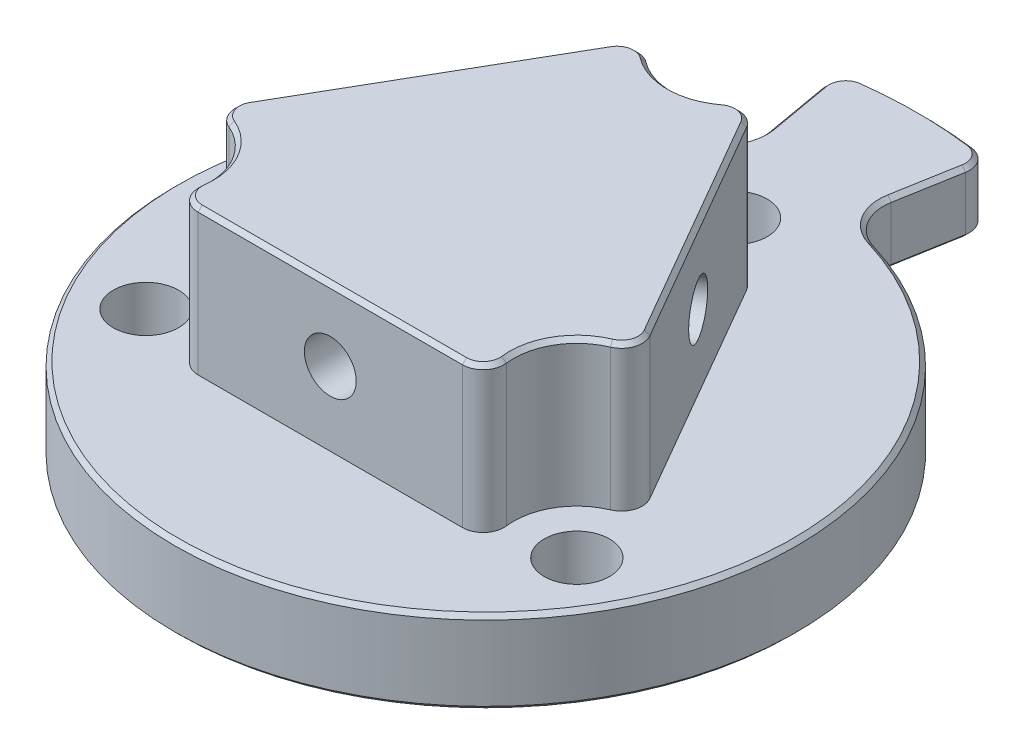
from build123d import *

# Parameters (mm, degrees)
SKETCH_1_R               = 15
SKETCH_1_R_2             = 1.575
EXTRUDE_1_DEPTH          = 4
EXTRUDE_2_DEPTH          = 7
SKETCH_8_R               = 3.05
CUT_EXTRUDE_3_DEPTH      = 7
FILLET_4_R               = 1
SKETCH_10_R              = 1
CUT_EXTRUDE_4_DEPTH      = 5
PATTERN_CIRCULAR_2_COUNT = 3
EXTRUDE_3_DEPTH          = 3
FILLET_5_R               = 1
FILLET_7_R               = 2
CHAMFER_1_SIZE           = 0.2
F_3_0MM_1_D              = 3
F_3_0MM_1_DEPTH          = 3
F_3_0MM_1_TIP            = 0.901290929


with BuildPart() as part:
    # 草图1 → 凸台-拉伸1 (new body)
    with BuildSketch(Plane(origin=(0, 0, 0), x_dir=(1, 0, 0), z_dir=(0, 1, 0))):
        with Locations(Location((0, 0, 0), (0, 0, 270))):
            Circle(SKETCH_1_R)
        with Locations(Location((0, 12, 0), (0, 0, 270))):
            Circle(SKETCH_1_R_2, mode=Mode.SUBTRACT)
        with Locations(Location((10.392304845, -6, 0), (0, 0, 270))):
            Circle(SKETCH_1_R_2, mode=Mode.SUBTRACT)
        with Locations(Location((-10.392304845, -6, 0), (0, 0, 270))):
            Circle(SKETCH_1_R_2, mode=Mode.SUBTRACT)
    extrude(amount=EXTRUDE_1_DEPTH)

    # 草图3 → 凸台-拉伸2 (add)
    with BuildSketch(Plane(origin=(0, 4, 0), x_dir=(1, 0, 0), z_dir=(0, 1, 0))):
        with BuildLine():
            Line((-7.794228634, -7.5), (7.794228634, -7.5))
            ThreePointArc((7.794228634, -7.5), (10.392304845, -6), (10.392304845, -3))
            Line((10.392304845, -3), (2.598076211, 10.5))
            ThreePointArc((2.598076211, 10.5), (0, 12), (-2.598076211, 10.5))
            Line((-2.598076211, 10.5), (-10.392304845, -3))
            ThreePointArc((-10.392304845, -3), (-10.392304845, -6), (-7.794228634, -7.5))
        make_face()
    extrude(amount=EXTRUDE_2_DEPTH)

    # 草图8 → 切除-拉伸3 (cut)
    with BuildSketch(Plane(origin=(0, 11, 0), x_dir=(1, 0, 0), z_dir=(0, 1, 0))):
        with Locations((-10.392304845, -6)):
            Circle(SKETCH_8_R)
        with Locations((10.392304845, -6)):
            Circle(SKETCH_8_R)
        with Locations((0, 12)):
            Circle(SKETCH_8_R)
    extrude(amount=-CUT_EXTRUDE_3_DEPTH, mode=Mode.SUBTRACT)

    # 圆角4
    fillet_4_edges = [part.edges().sort_by_distance(p)[0] for p in [
        (-7.7366505, 7.5, 7.5),
        (-10.363515779, 7.5, 2.950135874),
        (7.7366505, 7.5, 7.5),
        (10.363515779, 7.5, 2.950135874),
        (2.626865278, 7.5, -10.450135874),
        (-2.626865278, 7.5, -10.450135874),
    ]]
    fillet(fillet_4_edges, radius=FILLET_4_R)

    # 草图10 → 切除-拉伸4 (cut)
    with BuildSketch(Plane(origin=(6.495190528, 0, -3.75), x_dir=(-0.4999999999999998, 0, -0.8660254037844388), z_dir=(0.8660254037844388, 0, -0.4999999999999998))):
        with Locations((0, 7.55)):
            Circle(SKETCH_10_R)
    cut_extrude_4 = extrude(amount=-CUT_EXTRUDE_4_DEPTH, mode=Mode.SUBTRACT)

    # 草图13 → M3 螺纹孔1 (revolve, cut)
    with BuildSketch(Plane(origin=(6.495190528, 7.55, -3.75), x_dir=(-0.4999999999999998, 0, -0.8660254037844388), z_dir=(0, 1, 0))):
        Polygon((0, 0), (0, 5.751075774), (1.25, 5), (1.25, 0), align=None)
    hole_wizard_m3_1 = revolve(axis=Axis((11.994451842, 7.55, -6.925), (-0.8660254037844388, 0, 0.4999999999999998)), mode=Mode.SUBTRACT)

    # 阵列(圆周)2: 切除-拉伸4, M3 螺纹孔1 ×3 about axis
    pattern_circular_2_axis = Axis((0, 4, 0), (0, -1, 0))
    add([cut_extrude_4.rotate(pattern_circular_2_axis, i * 360 / PATTERN_CIRCULAR_2_COUNT) for i in range(1, PATTERN_CIRCULAR_2_COUNT)], mode=Mode.SUBTRACT)
    add([hole_wizard_m3_1.rotate(pattern_circular_2_axis, i * 360 / PATTERN_CIRCULAR_2_COUNT) for i in range(1, PATTERN_CIRCULAR_2_COUNT)], mode=Mode.SUBTRACT)

    # 草图20 → 凸台-拉伸3 (add)
    with BuildSketch(Plane(origin=(0, 1, 0), x_dir=(-1, 0, 0), z_dir=(0, -1, 0))):
        with BuildLine():
            Line((-3.646611731, 20.680962813), (-2.604722665, 14.772116295))
            ThreePointArc((-2.604722665, 14.772116295), (0, 15), (2.604722665, 14.772116295))
            Line((2.604722665, 14.772116295), (3.646611731, 20.680962813))
            ThreePointArc((3.646611731, 20.680962813), (0, 21), (-3.646611731, 20.680962813))
        make_face()
    extrude(amount=-EXTRUDE_3_DEPTH)

    # 圆角5
    fillet_5_edges = [part.edges().sort_by_distance(p)[0] for p in [
        (-3.646611731, 2.5, -20.680962813),
        (3.646611731, 2.5, -20.680962813),
    ]]
    fillet(fillet_5_edges, radius=FILLET_5_R)

    # 圆角7
    fillet_7_edges = [part.edges().sort_by_distance(p)[0] for p in [
        (2.604722665, 2.5, -14.772116295),
        (-2.604722665, 2.5, -14.772116295),
    ]]
    fillet(fillet_7_edges, radius=FILLET_7_R)

    # 倒角1
    # the kernel refuses this chamfer: 0.2 mm, written as the material it takes off along each edge
    with BuildSketch(Plane(origin=(-2.442521348, 11, -8.769428926), x_dir=(0.6030916909390288, 0, -0.7976718700821178), z_dir=(0.7976718700821178, 0, 0.6030916909390288))) as chamfer_1_piece_1:
        Polygon((1 - CHAMFER_1_SIZE, 0), (1, -CHAMFER_1_SIZE), (1, 0), align=None)
    revolve(axis=Axis((-2.442521348, 11, -8.769428926), (0, 1, 0)), revolution_arc=97.091646084, mode=Mode.SUBTRACT)
    with BuildSketch(Plane(origin=(2.442521348, 11, -8.769428926), x_dir=(0.8660254037844386, 0, -0.4999999999999999), z_dir=(0.4999999999999999, 0, 0.8660254037844386))) as chamfer_1_piece_2:
        Polygon((1 - CHAMFER_1_SIZE, 0), (1, -CHAMFER_1_SIZE), (1, 0), align=None)
    revolve(axis=Axis((2.442521348, 11, -8.769428926), (0, 1, 0)), revolution_arc=97.091646084, mode=Mode.SUBTRACT)
    with BuildSketch(Plane(origin=(0, 1, 0), x_dir=(-0.12419059396175354, 0, -0.9922583818600007), z_dir=(-0.9922583818600007, 0, 0.12419059396175354))) as chamfer_1_piece_3:
        Polygon((21 - CHAMFER_1_SIZE, 0), (21, -CHAMFER_1_SIZE), (21, 0), align=None)
    revolve(axis=Axis((0, 1, 0), (0, -1, 0)), revolution_arc=14.268032035, mode=Mode.SUBTRACT)
    with BuildSketch(Plane(origin=(3.468619632, 1, -19.67151946), x_dir=(-0.9844354138551702, -0.027495876610586265, -0.1735825242275703), z_dir=(-0.17364817766693033, 0, 0.9848077530122081))) as chamfer_1_piece_4:
        Polygon((CHAMFER_1_SIZE * 0.999621916911, -CHAMFER_1_SIZE * 0.0274958766106), (-CHAMFER_1_SIZE * 0.0274958766106, -CHAMFER_1_SIZE * 0.999621916911), (0, 0), align=None)
    extrude(amount=3.093041339, mode=Mode.SUBTRACT)
    with BuildSketch(Plane(origin=(2.483811879, 1, -19.845167637), x_dir=(0.9848077530122081, 0, 0.17364817766693008), z_dir=(-0.17364817766693008, 0, 0.9848077530122081))) as chamfer_1_piece_5:
        Polygon((1 - CHAMFER_1_SIZE, 0), (1, CHAMFER_1_SIZE), (1, 0), align=None)
    revolve(axis=Axis((2.483811879, 1, -19.845167637), (0, 1, 0)), revolution_arc=92.865983983, mode=Mode.SUBTRACT)
    with BuildSketch(Plane(origin=(-2.483811879, 1, -19.845167637), x_dir=(-0.9848077530122081, 0, 0.17364817766693008), z_dir=(0.17364817766693008, 0, 0.9848077530122081))) as chamfer_1_piece_6:
        Polygon((1 - CHAMFER_1_SIZE, 0), (1, -CHAMFER_1_SIZE), (1, 0), align=None)
    revolve(axis=Axis((-2.483811879, 1, -19.845167637), (0, -1, 0)), revolution_arc=92.865983983, mode=Mode.SUBTRACT)
    with BuildSketch(Plane(origin=(0, 4, 0), x_dir=(-0.12419059396175354, 0, -0.9922583818600007), z_dir=(-0.9922583818600007, 0, 0.12419059396175354))) as chamfer_1_piece_7:
        Polygon((21 - CHAMFER_1_SIZE, 0), (21, CHAMFER_1_SIZE), (21, 0), align=None)
    revolve(axis=Axis((0, 4, 0), (0, -1, 0)), revolution_arc=14.268032035, mode=Mode.SUBTRACT)
    with BuildSketch(Plane(origin=(3.468619632, 4, -19.67151946), x_dir=(-0.9844354138551702, 0.027495876610587344, -0.1735825242275703), z_dir=(-0.17364817766693033, 0, 0.9848077530122081)), Plane(origin=(-2.93151864, 4, -16.625468368), x_dir=(0.9844354138551702, 0.027495876610587403, -0.17358252422757026), z_dir=(-0.17364817766693033, 0, -0.9848077530122081)), Plane(origin=(-2.93151864, 1, -16.625468368), x_dir=(-0.02707815246196976, 0.9996219169112968, 0.004774608866782614), z_dir=(-0.17364817766693033, 0, -0.9848077530122081))) as chamfer_1_piece_8:
        Polygon((CHAMFER_1_SIZE * 0.999621916911, CHAMFER_1_SIZE * 0.0274958766106), (-CHAMFER_1_SIZE * 0.0274958766106, CHAMFER_1_SIZE * 0.999621916911), (0, 0), align=None)
    extrude(amount=3.093041339, mode=Mode.SUBTRACT)
    with BuildSketch(Plane(origin=(2.483811879, 4, -19.845167637), x_dir=(0.9848077530122081, 0, 0.17364817766693008), z_dir=(-0.17364817766693008, 0, 0.9848077530122081))) as chamfer_1_piece_9:
        Polygon((1 - CHAMFER_1_SIZE, 0), (1, -CHAMFER_1_SIZE), (1, 0), align=None)
    revolve(axis=Axis((2.483811879, 4, -19.845167637), (0, 1, 0)), revolution_arc=92.865983983, mode=Mode.SUBTRACT)
    with BuildSketch(Plane(origin=(-2.483811879, 4, -19.845167637), x_dir=(-0.9848077530122081, 0, 0.17364817766693008), z_dir=(0.17364817766693008, 0, 0.9848077530122081))) as chamfer_1_piece_10:
        Polygon((1 - CHAMFER_1_SIZE, 0), (1, CHAMFER_1_SIZE), (1, 0), align=None)
    revolve(axis=Axis((-2.483811879, 4, -19.845167637), (0, -1, 0)), revolution_arc=92.865983983, mode=Mode.SUBTRACT)
    with BuildSketch(Plane(origin=(0, 4, 0), x_dir=(0, 0, 1), z_dir=(1, 0, 0))) as chamfer_1_piece_11:
        Polygon((15 - CHAMFER_1_SIZE, 0), (15, CHAMFER_1_SIZE), (15, 0), align=None)
    revolve(axis=Axis((0, 4, 0), (0, -1, 0)), revolution_arc=163.243672969, mode=Mode.SUBTRACT)
    with BuildSketch(Plane(origin=(-4.901134146, 1, -16.278172013), x_dir=(0.03518913738514584, 0, 0.9993806705205426), z_dir=(-0.9993806705205426, 0, 0.03518913738514584))) as chamfer_1_piece_12_section:
        Polygon((2 + CHAMFER_1_SIZE, 0), (2, CHAMFER_1_SIZE), (2, 0), align=None)
    chamfer_1_piece_12 = revolve(axis=Axis((-4.901134146, 1, -16.278172013), (0, 1, 0)), revolution_arc=97.983394612, mode=Mode.PRIVATE)
    chamfer_1_piece_12 = chamfer_1_piece_12 - Plane(origin=(0, 1.09755955, 0), x_dir=(0, 0, 1), z_dir=(0, -1, 0)) * Cylinder(15, 9, mode=Mode.PRIVATE)
    add(chamfer_1_piece_12, mode=Mode.SUBTRACT)
    with BuildSketch(Plane(origin=(-4.901134146, 4, -16.278172013), x_dir=(0.28830200860312294, 0, 0.9575395301685488), z_dir=(-0.9575395301685488, 0, 0.28830200860312294))) as chamfer_1_piece_13:
        Polygon((2 + CHAMFER_1_SIZE, 0), (2, -CHAMFER_1_SIZE), (2, 0), align=None)
    revolve(axis=Axis((-4.901134146, 4, -16.278172013), (0, 1, 0)), revolution_arc=83.243672969, mode=Mode.SUBTRACT)
    with BuildSketch(Plane(origin=(4.901134146, 1, -16.278172013), x_dir=(-0.9848077530122081, 0, -0.17364817766693008), z_dir=(0.17364817766693008, 0, -0.9848077530122081))) as chamfer_1_piece_14_section:
        Polygon((2 + CHAMFER_1_SIZE, 0), (2, CHAMFER_1_SIZE), (2, 0), align=None)
    chamfer_1_piece_14 = revolve(axis=Axis((4.901134146, 1, -16.278172013), (0, 1, 0)), revolution_arc=97.983394612, mode=Mode.PRIVATE)
    chamfer_1_piece_14 = chamfer_1_piece_14 - Plane(origin=(0, 1.056839913, 0), x_dir=(0, 0, 1), z_dir=(0, -1, 0)) * Cylinder(15, 9, mode=Mode.PRIVATE)
    add(chamfer_1_piece_14, mode=Mode.SUBTRACT)
    with BuildSketch(Plane(origin=(4.901134146, 4, -16.278172013), x_dir=(-0.9848077530122081, 0, -0.17364817766693008), z_dir=(0.17364817766693008, 0, -0.9848077530122081))) as chamfer_1_piece_15:
        Polygon((2 + CHAMFER_1_SIZE, 0), (2, -CHAMFER_1_SIZE), (2, 0), align=None)
    revolve(axis=Axis((4.901134146, 4, -16.278172013), (0, 1, 0)), revolution_arc=83.243672969, mode=Mode.SUBTRACT)
    with BuildSketch(Plane(origin=(0, 0, 0), x_dir=(0, 0, 1), z_dir=(-1, 0, 0))) as chamfer_1_piece_16:
        Polygon((15 - CHAMFER_1_SIZE, 0), (15, CHAMFER_1_SIZE), (15, 0), align=None)
    revolve(axis=Axis((0, 0, 0), (0, 1, 0)), mode=Mode.SUBTRACT)
    with BuildSketch(Plane(origin=(9.681834305, 11, 1.769428926), x_dir=(-0.8656979742248805, 0.027495876610587163, 0.49981095845564805), z_dir=(-0.49999999999999967, 0, -0.8660254037844388)), Plane(origin=(-3.308546752, 11, -9.269428926), x_dir=(0.8656979742248803, 0.027495876610587444, 0.4998109584556484), z_dir=(-0.5000000000000001, 0, 0.8660254037844387)), Plane(origin=(-6.373287553, 11, 7.5), x_dir=(0, 0.027495876610587302, -0.9996219169112966), z_dir=(1, 0, 0))) as chamfer_1_piece_17:
        Polygon((CHAMFER_1_SIZE * 0.999621916911, -CHAMFER_1_SIZE * 0.0274958766106), (-CHAMFER_1_SIZE * 0.0274958766106, -CHAMFER_1_SIZE * 0.999621916911), (0, 0), align=None)
    extrude(amount=12.746575105, mode=Mode.SUBTRACT)
    with BuildSketch(Plane(origin=(-10.392304845, 11, 6), x_dir=(0.3892582579058555, 0, -0.9211286602055646), z_dir=(-0.9211286602055646, 0, -0.3892582579058555))) as chamfer_1_piece_18:
        Polygon((3.05 + CHAMFER_1_SIZE, 0), (3.05, CHAMFER_1_SIZE), (3.05, 0), align=None)
    revolve(axis=Axis((-10.392304845, 11, 6), (0, -1, 0)), revolution_arc=74.183292169, mode=Mode.SUBTRACT)
    with BuildSketch(Plane(origin=(10.392304845, 11, 6), x_dir=(-0.38925825790586327, 0, -0.9211286602055614), z_dir=(0.9211286602055614, 0, -0.38925825790586327))) as chamfer_1_piece_19:
        Polygon((3.05 + CHAMFER_1_SIZE, 0), (3.05, -CHAMFER_1_SIZE), (3.05, 0), align=None)
    revolve(axis=Axis((10.392304845, 11, 6), (0, 1, 0)), revolution_arc=74.183292169, mode=Mode.SUBTRACT)
    with BuildSketch(Plane(origin=(0, 11, -12), x_dir=(-0.6030916909390313, 0, 0.7976718700821159), z_dir=(-0.7976718700821159, 0, -0.6030916909390313))) as chamfer_1_piece_20:
        Polygon((3.05 + CHAMFER_1_SIZE, 0), (3.05, -CHAMFER_1_SIZE), (3.05, 0), align=None)
    revolve(axis=Axis((0, 11, -12), (0, 1, 0)), revolution_arc=74.183292169, mode=Mode.SUBTRACT)
    with BuildSketch(Plane(origin=(6.373287553, 11, 6.5), x_dir=(0.9923499488448717, 0, -0.12345679012343067), z_dir=(-0.12345679012343067, 0, -0.9923499488448717))) as chamfer_1_piece_21:
        Polygon((1, CHAMFER_1_SIZE), (1 - CHAMFER_1_SIZE, 0), (1, 0), align=None)
    revolve(axis=Axis((6.373287553, 11, 6.5), (0, -1, 0)), revolution_arc=97.091646084, mode=Mode.SUBTRACT)
    with BuildSketch(Plane(origin=(8.815808901, 11, 2.269428926), x_dir=(0.389258257905862, 0, 0.9211286602055619), z_dir=(-0.9211286602055619, 0, 0.389258257905862))) as chamfer_1_piece_22:
        Polygon((1 - CHAMFER_1_SIZE, 0), (1, -CHAMFER_1_SIZE), (1, 0), align=None)
    revolve(axis=Axis((8.815808901, 11, 2.269428926), (0, 1, 0)), revolution_arc=97.091646084, mode=Mode.SUBTRACT)
    with BuildSketch(Plane(origin=(-6.373287553, 11, 6.5), x_dir=(-0.9923499488448708, 0, -0.12345679012343777), z_dir=(0.12345679012343777, 0, -0.9923499488448708))) as chamfer_1_piece_23:
        Polygon((1 - CHAMFER_1_SIZE, 0), (1, -CHAMFER_1_SIZE), (1, 0), align=None)
    revolve(axis=Axis((-6.373287553, 11, 6.5), (0, 1, 0)), revolution_arc=97.091646084, mode=Mode.SUBTRACT)
    with BuildSketch(Plane(origin=(-8.815808901, 11, 2.269428926), x_dir=(-0.8660254037844396, 0, -0.4999999999999984), z_dir=(0.4999999999999984, 0, -0.8660254037844396))) as chamfer_1_piece_24:
        Polygon((1 - CHAMFER_1_SIZE, 0), (1, -CHAMFER_1_SIZE), (1, 0), align=None)
    revolve(axis=Axis((-8.815808901, 11, 2.269428926), (0, 1, 0)), revolution_arc=97.091646084, mode=Mode.SUBTRACT)
    with BuildSketch(Plane(origin=(0, 4, 0), x_dir=(0.28830200860312166, 0, -0.9575395301685491), z_dir=(-0.9575395301685491, 0, -0.28830200860312166))) as chamfer_1_piece_25:
        Polygon((15 - CHAMFER_1_SIZE, 0), (15, CHAMFER_1_SIZE), (15, 0), align=None)
    revolve(axis=Axis((0, 4, 0), (0, -1, 0)), revolution_arc=163.243672969, mode=Mode.SUBTRACT)

    # Ø3.0mm 暗销孔1
    with Locations(Plane(origin=(0, 0, 0), x_dir=(-1, 0, 0), z_dir=(0, -1, 0))):
        with Locations((-10.392304845, 6), (0, -12), (10.392304845, 6)):
            Hole(F_3_0MM_1_D / 2, depth=F_3_0MM_1_DEPTH)
            with Locations((0, 0, -(F_3_0MM_1_DEPTH + F_3_0MM_1_TIP / 2))):  # 118° drill point
                Cone(0, F_3_0MM_1_D / 2, F_3_0MM_1_TIP, mode=Mode.SUBTRACT)


solid = part.part
